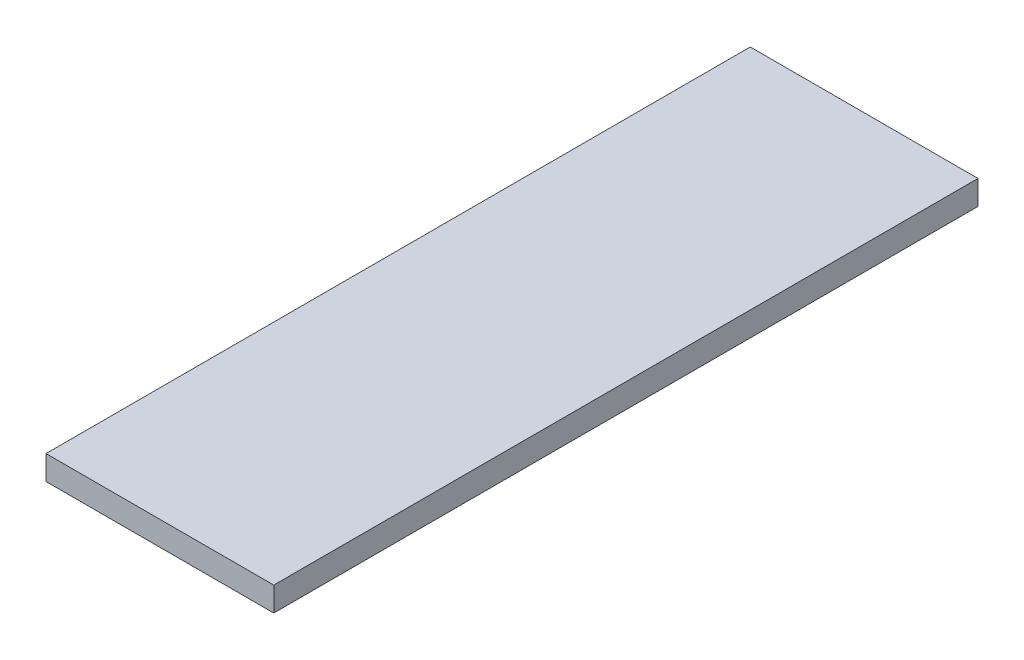
from build123d import *

# Parameters (mm, degrees)
BOSS_EXTRUDE1_DEPTH  = 2
BOSS_EXTRUDE5_DEPTH  = 1
SKETCH8_R            = 1.5
CUT_EXTRUDE1_DEPTH   = 67.539461976
SKETCH9_W            = 10.5
SKETCH9_H            = 10.5
CUT_EXTRUDE2_DEPTH   = 2
FILLET2_R            = 5
FILLET2_OF_MIRROR3_R = 5
MIRROR4_OUTLINE_R    = 1.5
MIRROR4_DEPTH        = 2
CHAMFER2_SIZE        = 1
CHAMFER1_SIZE        = 3
CUT_EXTRUDE3_START   = -0.5
CUT_EXTRUDE3_DEPTH   = 67.039461976
SKETCH12_W           = 95
SKETCH12_H           = 93
SKETCH12_W_2         = 18.798891394
SKETCH12_H_2         = 58.129040714
CUT_EXTRUDE4_DEPTH   = 67.539461976


# Read off the part's stored shape, not the designer's step: Mirror4
with BuildPart() as part:
    # Sketch1 → Boss-Extrude1 (new body)
    with BuildSketch(Plane(origin=(0, 0, 0), x_dir=(1, 0, 0), z_dir=(0, 1, 0))):
        Polygon((47.5, -43.5), (47.5, 43.5), (44.5, 46.5), (-44.5, 46.5), (-47.5, 43.5), (-47.5, -43.5), (-44.5, -46.5), (44.5, -46.5), align=None)
    extrude(amount=BOSS_EXTRUDE1_DEPTH)

    # Sketch7 → Boss-Extrude5 (add)
    with BuildSketch(Plane.XZ):
        Polygon((44.5, -46.5), (47.5, -43.5), (47.5, 43.5), (44.5, 46.5), (-44.5, 46.5), (-47.5, 43.5), (-47.5, -43.5), (-44.5, -46.5), align=None)
        Polygon((-45.5, -24.5), (-45.5, 24.5), (-25.5, 44.5), (25.5, 44.5), (45.5, 24.5), (45.5, -24.5), (25.5, -44.5), (-25.5, -44.5), align=None, mode=Mode.SUBTRACT)
    extrude(amount=BOSS_EXTRUDE5_DEPTH)

    # Sketch8 → Cut-Extrude1 (cut, through all)
    with BuildSketch(Plane.XZ.offset(1)):
        with Locations(Location((-42, 41, 0), (0, 0, 270))):
            Circle(SKETCH8_R)
        with Locations(Location((42, 41, 0), (0, 0, 270))):
            Circle(SKETCH8_R)
        with Locations(Location((42, -41, 0), (0, 0, 270))):
            Circle(SKETCH8_R)
        with Locations(Location((-42, -41, 0), (0, 0, 270))):
            Circle(SKETCH8_R)
    extrude(amount=-CUT_EXTRUDE1_DEPTH, mode=Mode.SUBTRACT)

    # Sketch9 → Cut-Extrude2 (cut)
    with BuildSketch(Plane(origin=(0, 2, 0), x_dir=(1, 0, 0), z_dir=(0, 1, 0))):
        with Locations((-42.25, 41.25)):
            Rectangle(SKETCH9_W, SKETCH9_H)
    cut_extrude2 = extrude(amount=-CUT_EXTRUDE2_DEPTH, mode=Mode.SUBTRACT)

    # Fillet2
    fillet2_edges = [part.edges().sort_by_distance(p)[0] for p in [
        (-37, 1, -36),
    ]]
    fillet(fillet2_edges, radius=FILLET2_R)

    # Mirror3: Cut-Extrude2 across plane
    add(cut_extrude2.mirror(Plane(origin=(0, 0, 0), x_dir=(0, 0, 1), z_dir=(1, 0, 0))), mode=Mode.SUBTRACT)

    # Fillet2 of Mirror3
    fillet2_of_mirror3_edges = [part.edges().sort_by_distance(p)[0] for p in [
        (37, 1, -36),
    ]]
    fillet(fillet2_of_mirror3_edges, radius=FILLET2_OF_MIRROR3_R)

    # Mirror4 outline → Mirror4 (cut)
    # profile 1 of 2: a face of its own
    with BuildSketch(Plane(origin=(0, 0, 0), x_dir=(1, 0, 0), z_dir=(0, 1, 0))):
        with BuildLine():
            Line((37, -41), (37, -46.5))
            Line((37, -46.5), (44.5, -46.5))
            Line((44.5, -46.5), (47.5, -43.5))
            Line((47.5, -43.5), (47.5, -36))
            Line((47.5, -36), (42, -36))
            ThreePointArc((42, -36), (38.464466094, -37.464466094), (37, -41))
        make_face()
        with Locations((42, -41)):
            Circle(MIRROR4_OUTLINE_R, mode=Mode.SUBTRACT)
    # profile 2 of 2: a face of its own
    with BuildSketch(Plane(origin=(0, 0, 0), x_dir=(1, 0, 0), z_dir=(0, 1, 0))):
        with BuildLine():
            Line((-37, -46.5), (-37, -41))
            ThreePointArc((-37, -41), (-38.464466094, -37.464466094), (-42, -36))
            Line((-42, -36), (-47.5, -36))
            Line((-47.5, -36), (-47.5, -43.5))
            Line((-47.5, -43.5), (-44.5, -46.5))
            Line((-44.5, -46.5), (-37, -46.5))
        make_face()
        with Locations((-42, -41)):
            Circle(MIRROR4_OUTLINE_R, mode=Mode.SUBTRACT)
    extrude(amount=MIRROR4_DEPTH, mode=Mode.SUBTRACT)

    # Chamfer2
    chamfer2_edges = [part.edges().sort_by_distance(p)[0] for p in [
        (-46, 0, 45),
        (46, 0, 45),
        (46, 0, -45),
        (-46, 0, -45),
    ]]
    chamfer(chamfer2_edges, length=CHAMFER2_SIZE - 0.0001)  # a hair under: the kernel refuses the full size

    # Chamfer1
    chamfer1_edges = [part.edges().sort_by_distance(p)[0] for p in [
        (47.5, 2, 0),
        (0, 2, -46.5),
        (-47.5, 2, 0),
        (0, 2, 46.5),
    ]]
    chamfer(chamfer1_edges, length=CHAMFER1_SIZE - 0.0001)  # a hair under: the kernel refuses the full size

    # Sketch11 → Cut-Extrude3 (cut, through all)
    # profile 1 of 5: a face of its own
    with BuildSketch(Plane(origin=(0, 2, 0), x_dir=(1, 0, 0), z_dir=(0, 1, 0)).offset(CUT_EXTRUDE3_START)):
        with BuildLine():
            Line((-2.96964558, 11.609823917), (2.684942756, 11.609823917))
            add(Edge.make_bspline(
                [(2.684942756, 11.609823917), (2.777321738, 11.611776071), (2.957391943, 11.615581316), (3.219120893, 11.650328301), (3.464419674, 11.707868164), (3.691605394, 11.791263919), (3.903384111, 11.89380175), (4.09705776, 12.021947729), (4.272833559, 12.174104626), (4.431408637, 12.348792332), (4.573358623, 12.545630483), (4.694186475, 12.766291094), (4.798170129, 13.00852758), (4.880656827, 13.273890976), (4.948515017, 13.560811829), (4.992640174, 13.870858563), (5.023026869, 14.202372497), (5.026731398, 14.431028545), (5.028640829, 14.548885077)],
                knots=[0, 0, 0, 0, 1.034928103, 2.017338911, 2.952994127, 3.853038192, 4.724242918, 5.58444331, 6.447693392, 7.323153255, 8.223014811, 9.160971226, 10.137008122, 11.172588677, 12.271517983, 13.437861302, 14.679392988, 16, 16, 16, 16], degree=3))
            Line((5.028640829, 14.548885077), (5.03035442, 23.359224244))
            Line((5.03035442, 23.359224244), (-2.96964558, 23.359224244))
            Line((-2.96964558, 23.359224244), (-2.96964558, 20.833873821))
            Line((-2.96964558, 20.833873821), (3.068088594, 20.833873821))
            Line((3.068088594, 20.833873821), (3.068088594, 18.747199292))
            Line((3.068088594, 18.747199292), (-2.96964558, 18.747199292))
            Line((-2.96964558, 18.747199292), (-2.96964558, 16.24556108))
            Line((-2.96964558, 16.24556108), (3.068088594, 16.24556108))
            Line((3.068088594, 16.24556108), (3.068088594, 15.071806657))
            add(Edge.make_bspline(
                [(3.068088594, 15.071806657), (3.064209945, 15.000818284), (3.056817159, 14.865512946), (3.017415302, 14.673744126), (2.945687753, 14.507567483), (2.849227659, 14.366066065), (2.727507434, 14.25259732), (2.583404565, 14.169824506), (2.418095172, 14.12159896), (2.301681966, 14.11381315), (2.241333797, 14.109777015)],
                knots=[0, 0, 0, 0, 1.19415961, 2.276093407, 3.270406576, 4.216705333, 5.134670092, 6.042926015, 6.985460194, 8, 8, 8, 8], degree=3))
            Line((2.241333797, 14.109777015), (-2.96964558, 14.11146213))
            Line((-2.96964558, 14.11146213), (-2.96964558, 11.609823917))
        make_face()
    # profile 2 of 5: a face of its own
    with BuildSketch(Plane(origin=(0, 2, 0), x_dir=(1, 0, 0), z_dir=(0, 1, 0)).offset(CUT_EXTRUDE3_START)):
        with BuildLine():
            add(Edge.make_bspline(
                [(-2.969643905, 5.897576517), (-2.96809823, 5.762393842), (-2.96510144, 5.500298648), (-2.929912456, 5.121392409), (-2.87499534, 4.769490356), (-2.793861736, 4.445422743), (-2.69218258, 4.147075951), (-2.565284779, 3.876511497), (-2.414802382, 3.633303118), (-2.241004585, 3.416920199), (-2.040781676, 3.227928976), (-1.816319116, 3.063784889), (-1.565759235, 2.926444756), (-1.290799144, 2.81536465), (-0.991662355, 2.727164042), (-0.6669311, 2.666912194), (-0.31752516, 2.630762625), (-0.076652983, 2.626535645), (0.047508754, 2.624356775)],
                knots=[0, 0, 0, 0, 1.264098041, 2.450861568, 3.556059647, 4.592449321, 5.571738732, 6.499987297, 7.381518289, 8.240985537, 9.088387607, 9.949500598, 10.835174967, 11.753837337, 12.718427414, 13.747394228, 14.838855326, 16, 16, 16, 16], degree=3))
            add(Edge.make_bspline(
                [(0.047508754, 2.624356775), (0.171095874, 2.626551583), (0.410821754, 2.630808922), (0.758005311, 2.666670781), (1.080872887, 2.727637172), (1.378936289, 2.815380518), (1.653544658, 2.926063957), (1.902865397, 3.06377138), (2.125673229, 3.228464079), (2.325778761, 3.416860744), (2.4995069, 3.633321561), (2.650048319, 3.87649842), (2.776770089, 4.147111295), (2.879099814, 4.44515456), (2.9573934, 4.76978309), (3.013110652, 5.121345958), (3.048045309, 5.500147868), (3.051086762, 5.762070079), (3.052654551, 5.897084048)],
                knots=[0, 0, 0, 0, 1.158186699, 2.246571676, 3.267136807, 4.233719281, 5.154279183, 6.037094379, 6.895664914, 7.744817325, 8.606059835, 9.489411662, 10.419577559, 11.400889729, 12.438133347, 13.545614255, 14.734829086, 16, 16, 16, 16], degree=3))
            Line((3.052654551, 5.897084048), (3.054368142, 7.628567887))
            add(Edge.make_bspline(
                [(3.054368142, 7.628567887), (3.052087435, 7.763890556), (3.047668129, 8.026104083), (3.013084169, 8.405794119), (2.957354846, 8.758506564), (2.879272217, 9.084301846), (2.777305112, 9.382616378), (2.648957847, 9.652321383), (2.500679253, 9.896375076), (2.325110068, 10.1115118), (2.125686864, 10.299745598), (1.903387676, 10.464985632), (1.652577425, 10.599590217), (1.379762675, 10.714045364), (1.080448398, 10.79819074), (0.758080474, 10.860049476), (0.410830224, 10.896140128), (0.171093256, 10.899026602), (0.047508754, 10.90051458)],
                knots=[0, 0, 0, 0, 1.26769055, 2.456392651, 3.568684506, 4.61068505, 5.591574127, 6.516496223, 7.404021586, 8.260732698, 9.109518996, 9.967719358, 10.847564872, 11.769768271, 12.734432948, 13.754558062, 14.842473782, 16, 16, 16, 16], degree=3))
            add(Edge.make_bspline(
                [(0.047508754, 10.90051458), (-0.0766503, 10.899042356), (-0.317533369, 10.89618607), (-0.667006901, 10.859809497), (-0.991235068, 10.798654526), (-1.291624123, 10.714059119), (-1.564794291, 10.599205964), (-1.816840344, 10.46497672), (-2.0407965, 10.300281373), (-2.240335992, 10.111452571), (-2.415974835, 9.896393582), (-2.564194044, 9.652308377), (-2.692717348, 9.382651147), (-2.794030128, 9.084035403), (-2.874983026, 8.758798699), (-2.929782862, 8.405745261), (-2.965159875, 8.025884885), (-2.968116647, 7.763379115), (-2.969643905, 7.627787307)],
                knots=[0, 0, 0, 0, 1.160429975, 2.251369709, 3.27984501, 4.242476435, 5.162736078, 6.045417472, 6.90611913, 7.753116416, 8.608021813, 9.493676512, 10.416649122, 11.395470751, 12.436552129, 13.546499574, 14.732696212, 16, 16, 16, 16], degree=3))
            Line((-2.969643905, 7.627787307), (-2.969643905, 5.897576517))
        make_face()
        with BuildLine():
            add(Edge.make_bspline(
                [(-1.117156769, 7.201748097), (-1.115892009, 7.263204152), (-1.113466534, 7.381060518), (-1.093814198, 7.549114214), (-1.066603664, 7.700982372), (-1.032007566, 7.837974531), (-0.983621973, 7.957891777), (-0.927608702, 8.062719477), (-0.859749528, 8.150359496), (-0.755742939, 8.243937259), (-0.605346135, 8.33174352), (-0.40667012, 8.407254005), (-0.185594743, 8.446420315), (-0.032099093, 8.446123212), (0.047508754, 8.445969125)],
                knots=[0, 0, 0, 0, 1.116668216, 2.14147261, 3.070955002, 3.920427669, 4.703899179, 5.415499754, 6.074466061, 6.707094748, 7.947527221, 9.213680472, 10.554923887, 12, 12, 12, 12], degree=3))
            add(Edge.make_bspline(
                [(0.047508754, 8.445969125), (0.125977156, 8.446140141), (0.277211685, 8.446469744), (0.495425914, 8.407021022), (0.691722076, 8.331605781), (0.841018613, 8.244392597), (0.942772874, 8.149763601), (1.010694357, 8.062797422), (1.066601973, 7.957867111), (1.115060305, 7.837985222), (1.149462925, 7.700965611), (1.177455325, 7.549237278), (1.193745477, 7.380537052), (1.197961431, 7.262466281), (1.200167416, 7.200686106)],
                knots=[0, 0, 0, 0, 1.431661465, 2.759284488, 4.022212845, 5.260141476, 5.888357472, 6.550729177, 7.266007152, 8.053527476, 8.907390036, 9.841675796, 10.870663369, 12, 12, 12, 12], degree=3))
            Line((1.200167416, 7.200686106), (1.201881007, 6.407389044))
            add(Edge.make_bspline(
                [(1.201881007, 6.407389044), (1.198953268, 6.340754162), (1.193378539, 6.213874191), (1.177603253, 6.032856529), (1.149511961, 5.870852383), (1.115319944, 5.725262374), (1.066486398, 5.598091776), (1.011034516, 5.486809692), (0.94385937, 5.394378735), (0.840943888, 5.297437413), (0.692432767, 5.206643676), (0.495495759, 5.130197912), (0.277437281, 5.087752017), (0.126013429, 5.089831169), (0.047508754, 5.090909091)],
                knots=[0, 0, 0, 0, 1.179416097, 2.245734887, 3.209712096, 4.085060225, 4.884939085, 5.61290565, 6.278149703, 6.893097025, 8.101911108, 9.3278521, 10.614642948, 12, 12, 12, 12], degree=3))
            add(Edge.make_bspline(
                [(0.047508754, 5.090909091), (-0.032134762, 5.089848247), (-0.185816799, 5.087801216), (-0.406741834, 5.129956432), (-0.606055086, 5.206504149), (-0.75565704, 5.297891249), (-0.860861763, 5.393771355), (-0.927943294, 5.486891491), (-0.983509062, 5.598065875), (-1.032262488, 5.725273442), (-1.066672598, 5.870835591), (-1.093869806, 6.032975779), (-1.113523015, 6.213378553), (-1.115907879, 6.340137605), (-1.117156769, 6.40651801)],
                knots=[0, 0, 0, 0, 1.398530562, 2.698638094, 3.927816791, 5.139084209, 5.75826623, 6.420177815, 7.144497711, 7.940369665, 8.811332833, 9.770481103, 10.832459186, 12, 12, 12, 12], degree=3))
            Line((-1.117156769, 6.40651801), (-1.117156769, 7.201748097))
        make_face(mode=Mode.SUBTRACT)
    # profile 3 of 5: a face of its own
    with BuildSketch(Plane(origin=(0, 2, 0), x_dir=(1, 0, 0), z_dir=(0, 1, 0)).offset(CUT_EXTRUDE3_START)):
        with BuildLine():
            Line((-2.96964558, -3.836145208), (3.054369817, -6.610473842))
            Line((3.054369817, -6.610473842), (3.054369817, -4.013986787))
            Line((3.054369817, -4.013986787), (0.523436404, -2.875800681))
            add(Edge.make_bspline(
                [(0.523436404, -2.875800681), (0.423165964, -2.831315113), (0.232788556, -2.746853062), (-0.039178136, -2.628435976), (-0.281366415, -2.522983302), (-0.498250545, -2.435597621), (-0.689708347, -2.358366422), (-0.861747025, -2.295653669), (-1.013040364, -2.240988801), (-1.109008452, -2.213388861), (-1.153177353, -2.200686106)],
                knots=[0, 0, 0, 0, 1.455589859, 2.763640238, 3.936176174, 4.960433838, 5.86632832, 6.675283895, 7.390305104, 8, 8, 8, 8], degree=3))
            Line((-1.153177353, -2.200686106), (-1.1518172, -2.140722154))
            add(Edge.make_bspline(
                [(-1.1518172, -2.140722154), (-1.108132861, -2.129080481), (-1.012726058, -2.103655014), (-0.861008018, -2.053532951), (-0.690216022, -1.989078406), (-0.497712652, -1.915116967), (-0.282150745, -1.826195692), (-0.039320891, -1.725174124), (0.23248881, -1.611926547), (0.422627629, -1.531273104), (0.522637399, -1.488850772)],
                knots=[0, 0, 0, 0, 0.603307338, 1.317626049, 2.131302103, 3.039698341, 4.06993283, 5.243370594, 6.550060044, 8, 8, 8, 8], degree=3))
            Line((0.522637399, -1.488850772), (3.054369817, -0.409730784))
            Line((3.054369817, -0.409730784), (3.054369817, 2.269749008))
            Line((3.054369817, 2.269749008), (-2.96964558, -0.397874678))
            Line((-2.96964558, -0.397874678), (-2.96964558, -3.836145208))
        make_face()
    # profile 4 of 5: a face of its own
    with BuildSketch(Plane(origin=(0, 2, 0), x_dir=(1, 0, 0), z_dir=(0, 1, 0)).offset(CUT_EXTRUDE3_START)):
        with BuildLine():
            Line((-2.969643905, -14.438434686), (-1.446487816, -14.438434686))
            Line((-1.446487816, -14.438434686), (-1.446487816, -10.502207735))
            add(Edge.make_bspline(
                [(-1.446487816, -10.502207735), (-1.444825189, -10.41810291), (-1.441724579, -10.261257), (-1.403157141, -10.043988868), (-1.337892707, -9.862451439), (-1.240320901, -9.716275332), (-1.110490668, -9.604952118), (-0.953002899, -9.520750276), (-0.764963738, -9.462154339), (-0.628728969, -9.44487077), (-0.556264831, -9.43567753)],
                knots=[0, 0, 0, 0, 1.277732666, 2.38282573, 3.340436924, 4.191726913, 5.02356834, 5.914561034, 6.890741783, 8, 8, 8, 8], degree=3))
            Line((-0.556264831, -9.43567753), (-0.55455124, -13.169831422))
            add(Edge.make_bspline(
                [(-0.55455124, -13.169831422), (-0.554789336, -13.23335729), (-0.555251979, -13.356794383), (-0.533165853, -13.535120028), (-0.500534614, -13.701349321), (-0.457666671, -13.856409461), (-0.396304951, -13.997753541), (-0.323913309, -14.128046953), (-0.238522335, -14.247022753), (-0.137529463, -14.352468826), (-0.023244792, -14.446339372), (0.106390479, -14.526432398), (0.249664691, -14.596174453), (0.409246164, -14.649630528), (0.582061384, -14.694992328), (0.770527029, -14.724720595), (0.972782546, -14.743887851), (1.112641366, -14.746506279), (1.184730023, -14.747855918)],
                knots=[0, 0, 0, 0, 1.128104803, 2.192020044, 3.186546858, 4.138575601, 5.044637778, 5.918201493, 6.78416576, 7.639570555, 8.506190517, 9.405674712, 10.342007044, 11.331901955, 12.391781028, 13.514498924, 14.7188764, 16, 16, 16, 16], degree=3))
            add(Edge.make_bspline(
                [(1.184730023, -14.747855918), (1.255675566, -14.747275837), (1.394462158, -14.746141059), (1.596498671, -14.725435014), (1.786513865, -14.689527583), (1.964599134, -14.638662953), (2.129895749, -14.569338642), (2.283468232, -14.485648057), (2.424089603, -14.384334123), (2.553309727, -14.268290374), (2.668591802, -14.131872488), (2.767887819, -13.974765238), (2.852022406, -13.796639402), (2.919755372, -13.59782911), (2.974993132, -13.378804734), (3.013271921, -13.138311096), (3.037550101, -12.876996301), (3.040720523, -12.69588356), (3.042362956, -12.602058319)],
                knots=[0, 0, 0, 0, 1.042407244, 2.039199948, 2.980341081, 3.881927717, 4.755949004, 5.609777407, 6.44702504, 7.297828833, 8.156523805, 9.063421748, 10.021999443, 11.0452595, 12.145933517, 13.338272575, 14.621095259, 16, 16, 16, 16], degree=3))
            Line((3.042362956, -12.602058319), (3.044076547, -9.790841418))
            add(Edge.make_bspline(
                [(3.044076547, -9.790841418), (3.04315063, -9.663842041), (3.04136363, -9.41873576), (3.016878364, -9.066071992), (2.969408475, -8.743014322), (2.900221888, -8.45028764), (2.807721271, -8.187119429), (2.693584465, -7.954227559), (2.556657662, -7.751632895), (2.396207931, -7.57811601), (2.207242463, -7.431468022), (1.989873049, -7.30590808), (1.73987494, -7.204356691), (1.460870143, -7.120183284), (1.150016762, -7.05827562), (0.808579497, -7.013573258), (0.435430723, -6.992550201), (0.17674389, -6.992937661), (0.042362956, -6.993138937)],
                knots=[0, 0, 0, 0, 1.258396768, 2.428680835, 3.500032431, 4.490868068, 5.404832769, 6.25876339, 7.053962379, 7.819709927, 8.590471974, 9.415549799, 10.299444184, 11.258403516, 12.299605236, 13.436720094, 14.668444213, 16, 16, 16, 16], degree=3))
            add(Edge.make_bspline(
                [(0.042362956, -6.993138937), (-0.094328315, -6.993892379), (-0.357729193, -6.995344244), (-0.736591827, -7.022051945), (-1.082903149, -7.071220459), (-1.396886334, -7.14105236), (-1.679902708, -7.23053518), (-1.930199129, -7.343386287), (-2.148529817, -7.478015464), (-2.334769531, -7.636410455), (-2.494160229, -7.818580184), (-2.62801793, -8.02733001), (-2.741905217, -8.261352332), (-2.829626081, -8.524244707), (-2.900515351, -8.811396529), (-2.944825214, -9.126857993), (-2.971411675, -9.467794347), (-2.970246724, -9.704349508), (-2.969643905, -9.826758148)],
                knots=[0, 0, 0, 0, 1.350278417, 2.601954884, 3.749142547, 4.803008632, 5.776605991, 6.676557218, 7.50886608, 8.302331768, 9.082965266, 9.891450314, 10.745389055, 11.647535979, 12.624405394, 13.663758671, 14.791080597, 16, 16, 16, 16], degree=3))
            Line((-2.969643905, -9.826758148), (-2.969643905, -14.438434686))
        make_face()
        with BuildLine():
            add(Edge.make_bspline(
                [(1.541503648, -11.79452321), (1.540414436, -11.836820999), (1.538379989, -11.915825479), (1.517837452, -12.025684097), (1.48447843, -12.119314851), (1.43362506, -12.195215297), (1.368251858, -12.253920751), (1.28788058, -12.294256098), (1.192786553, -12.316455451), (1.124816983, -12.317022608), (1.088675134, -12.317324185)],
                knots=[0, 0, 0, 0, 1.270663288, 2.373365042, 3.347375387, 4.239149479, 5.091600922, 5.960539658, 6.915546086, 8, 8, 8, 8], degree=3))
            add(Edge.make_bspline(
                [(1.088675134, -12.317324185), (1.052535415, -12.316986588), (0.98401249, -12.316346484), (0.887858051, -12.29418288), (0.806079392, -12.25436944), (0.740108669, -12.195670784), (0.691579366, -12.118703641), (0.657346667, -12.025961321), (0.638966366, -11.916100263), (0.639167988, -11.837687157), (0.639275478, -11.795883362)],
                knots=[0, 0, 0, 0, 1.083849903, 2.055039921, 2.938830956, 3.790807608, 4.672591545, 5.646059393, 6.745061204, 8, 8, 8, 8], degree=3))
            Line((0.639275478, -11.795883362), (0.639275478, -9.43515826))
            add(Edge.make_bspline(
                [(0.639275478, -9.43515826), (0.712181915, -9.440493089), (0.850037966, -9.450580516), (1.040636476, -9.499320014), (1.200052337, -9.576111789), (1.33268415, -9.679421472), (1.429764468, -9.824178639), (1.497205511, -10.004635878), (1.534909979, -10.224306292), (1.538082939, -10.382926557), (1.539790057, -10.468267581)],
                knots=[0, 0, 0, 0, 1.110998818, 2.100746043, 2.972353025, 3.788988663, 4.626491954, 5.587839498, 6.702207136, 8, 8, 8, 8], degree=3))
            Line((1.539790057, -10.468267581), (1.541503648, -11.79452321))
        make_face(mode=Mode.SUBTRACT)
    # profile 5 of 5: a face of its own
    with BuildSketch(Plane(origin=(0, 2, 0), x_dir=(1, 0, 0), z_dir=(0, 1, 0)).offset(CUT_EXTRUDE3_START)):
        with BuildLine():
            add(Edge.make_bspline(
                [(-2.969643905, -20.229353157), (-2.96809823, -20.364535832), (-2.96510144, -20.626631026), (-2.929912456, -21.005537265), (-2.87499534, -21.357439318), (-2.793861736, -21.681506931), (-2.69218258, -21.979853723), (-2.565284779, -22.250418177), (-2.414802382, -22.493626556), (-2.241004585, -22.710009475), (-2.040781676, -22.899000698), (-1.816319116, -23.063144785), (-1.565759235, -23.200484919), (-1.290799144, -23.311565024), (-0.991662355, -23.399765632), (-0.6669311, -23.46001748), (-0.31752516, -23.496167049), (-0.076652983, -23.500394029), (0.047508754, -23.502572899)],
                knots=[0, 0, 0, 0, 1.264098041, 2.450861568, 3.556059647, 4.592449321, 5.571738732, 6.499987297, 7.381518289, 8.240985537, 9.088387607, 9.949500598, 10.835174967, 11.753837337, 12.718427414, 13.747394228, 14.838855326, 16, 16, 16, 16], degree=3))
            add(Edge.make_bspline(
                [(0.047508754, -23.502572899), (0.171095874, -23.500378091), (0.410821754, -23.496120752), (0.758005311, -23.460258893), (1.080872887, -23.399292502), (1.378936289, -23.311549156), (1.653544658, -23.200865718), (1.902865397, -23.063158294), (2.125673229, -22.898465595), (2.325778761, -22.71006893), (2.4995069, -22.493608113), (2.650048319, -22.250431254), (2.776770089, -21.979818379), (2.879099814, -21.681775114), (2.9573934, -21.357146584), (3.013110652, -21.005583716), (3.048045309, -20.626781806), (3.051086762, -20.364859595), (3.052654551, -20.229845626)],
                knots=[0, 0, 0, 0, 1.158186699, 2.246571676, 3.267136807, 4.233719281, 5.154279183, 6.037094379, 6.895664914, 7.744817325, 8.606059835, 9.489411662, 10.419577559, 11.400889729, 12.438133347, 13.545614255, 14.734829086, 16, 16, 16, 16], degree=3))
            Line((3.052654551, -20.229845626), (3.054368142, -18.498361787))
            add(Edge.make_bspline(
                [(3.054368142, -18.498361787), (3.052087435, -18.363039118), (3.047668129, -18.100825591), (3.013084169, -17.721135555), (2.957354846, -17.36842311), (2.879272217, -17.042627828), (2.777305112, -16.744313296), (2.648957847, -16.474608292), (2.500679253, -16.230554598), (2.325110068, -16.015417874), (2.125686864, -15.827184076), (1.903387676, -15.661944042), (1.652577425, -15.527339457), (1.379762675, -15.41288431), (1.080448398, -15.328738934), (0.758080474, -15.266880198), (0.410830224, -15.230789546), (0.171093256, -15.227903072), (0.047508754, -15.226415094)],
                knots=[0, 0, 0, 0, 1.26769055, 2.456392651, 3.568684506, 4.61068505, 5.591574127, 6.516496223, 7.404021586, 8.260732698, 9.109518996, 9.967719358, 10.847564872, 11.769768271, 12.734432948, 13.754558062, 14.842473782, 16, 16, 16, 16], degree=3))
            add(Edge.make_bspline(
                [(0.047508754, -15.226415094), (-0.0766503, -15.227887318), (-0.317533369, -15.230743604), (-0.667006901, -15.267120177), (-0.991235068, -15.328275148), (-1.291624123, -15.412870555), (-1.564794291, -15.52772371), (-1.816840344, -15.661952954), (-2.0407965, -15.826648301), (-2.240335992, -16.015477103), (-2.415974835, -16.230536092), (-2.564194044, -16.474621297), (-2.692717348, -16.744278527), (-2.794030128, -17.042894271), (-2.874983026, -17.368130975), (-2.929782862, -17.721184413), (-2.965159875, -18.101044789), (-2.968116647, -18.36355056), (-2.969643905, -18.499142367)],
                knots=[0, 0, 0, 0, 1.160429975, 2.251369709, 3.27984501, 4.242476435, 5.162736078, 6.045417472, 6.90611913, 7.753116416, 8.608021813, 9.493676512, 10.416649122, 11.395470751, 12.436552129, 13.546499574, 14.732696212, 16, 16, 16, 16], degree=3))
            Line((-2.969643905, -18.499142367), (-2.969643905, -20.229353157))
        make_face()
        with BuildLine():
            add(Edge.make_bspline(
                [(-1.117156769, -18.925181577), (-1.115892009, -18.863725522), (-1.113466534, -18.745869156), (-1.093814198, -18.57781546), (-1.066603664, -18.425947302), (-1.032007566, -18.288955143), (-0.983621973, -18.169037897), (-0.927608702, -18.064210197), (-0.859749528, -17.976570178), (-0.755742939, -17.882992415), (-0.605346135, -17.795186154), (-0.40667012, -17.719675669), (-0.185594743, -17.680509359), (-0.032099093, -17.680806462), (0.047508754, -17.680960549)],
                knots=[0, 0, 0, 0, 1.116668216, 2.14147261, 3.070955002, 3.920427669, 4.703899179, 5.415499754, 6.074466061, 6.707094748, 7.947527221, 9.213680472, 10.554923887, 12, 12, 12, 12], degree=3))
            add(Edge.make_bspline(
                [(0.047508754, -17.680960549), (0.125977156, -17.680789534), (0.277211685, -17.680459931), (0.495425914, -17.719908652), (0.691722076, -17.795323893), (0.841018613, -17.882537077), (0.942772874, -17.977166073), (1.010694357, -18.064132252), (1.066601973, -18.169062563), (1.115060305, -18.288944452), (1.149462925, -18.425964063), (1.177455325, -18.577692396), (1.193745477, -18.746392622), (1.197961431, -18.864463393), (1.200167416, -18.926243568)],
                knots=[0, 0, 0, 0, 1.431661465, 2.759284488, 4.022212845, 5.260141476, 5.888357472, 6.550729177, 7.266007152, 8.053527476, 8.907390036, 9.841675796, 10.870663369, 12, 12, 12, 12], degree=3))
            Line((1.200167416, -18.926243568), (1.201881007, -19.71954063))
            add(Edge.make_bspline(
                [(1.201881007, -19.71954063), (1.198953268, -19.786175512), (1.193378539, -19.913055483), (1.177603253, -20.094073145), (1.149511961, -20.256077291), (1.115319944, -20.4016673), (1.066486398, -20.528837898), (1.011034516, -20.640119982), (0.94385937, -20.732550939), (0.840943888, -20.829492261), (0.692432767, -20.920285998), (0.495495759, -20.996731762), (0.277437281, -21.039177658), (0.126013429, -21.037098506), (0.047508754, -21.036020583)],
                knots=[0, 0, 0, 0, 1.179416097, 2.245734887, 3.209712096, 4.085060225, 4.884939085, 5.61290565, 6.278149703, 6.893097025, 8.101911108, 9.3278521, 10.614642948, 12, 12, 12, 12], degree=3))
            add(Edge.make_bspline(
                [(0.047508754, -21.036020583), (-0.032134762, -21.037081427), (-0.185816799, -21.039128458), (-0.406741834, -20.996973242), (-0.606055086, -20.920425525), (-0.75565704, -20.829038425), (-0.860861763, -20.733158319), (-0.927943294, -20.640038183), (-0.983509062, -20.528863799), (-1.032262488, -20.401656232), (-1.066672598, -20.256094084), (-1.093869806, -20.093953895), (-1.113523015, -19.913551121), (-1.115907879, -19.786792069), (-1.117156769, -19.720411664)],
                knots=[0, 0, 0, 0, 1.398530562, 2.698638094, 3.927816791, 5.139084209, 5.75826623, 6.420177815, 7.144497711, 7.940369665, 8.811332833, 9.770481103, 10.832459186, 12, 12, 12, 12], degree=3))
            Line((-1.117156769, -19.720411664), (-1.117156769, -18.925181577))
        make_face(mode=Mode.SUBTRACT)
    extrude(amount=-CUT_EXTRUDE3_DEPTH, mode=Mode.SUBTRACT)

    # Sketch12 → Cut-Extrude4 (cut, through all)
    with BuildSketch(Plane(origin=(0, 2, 0), x_dir=(1, 0, 0), z_dir=(0, 1, 0))):
        Rectangle(SKETCH12_W, SKETCH12_H)
        Rectangle(SKETCH12_W_2, SKETCH12_H_2, mode=Mode.SUBTRACT)
    extrude(amount=-CUT_EXTRUDE4_DEPTH, mode=Mode.SUBTRACT)


solid = part.part
